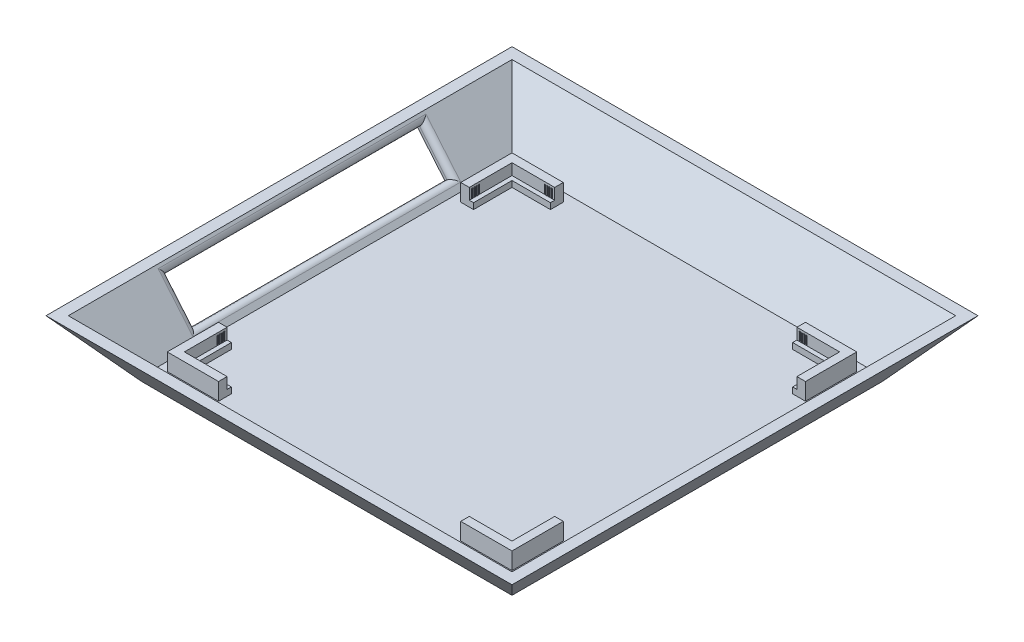
from build123d import *

# Parameters (mm, degrees)
SKETCH1_W            = 130
SKETCH1_H            = 130
BOSS_EXTRUDE1_DEPTH  = 20
BOSS_EXTRUDE1_DRAFT  = -40
SHELL1_T             = -3
BOSS_EXTRUDE2_DEPTH  = 6
BOSS_EXTRUDE3_DEPTH  = 2.1
SKETCH4_W            = 0.4
SKETCH4_H            = 3
BOSS_EXTRUDE4_DEPTH  = 0.2
CHAMFER2_SIZE        = 0.15
SKETCH5_W            = 0.4
SKETCH5_H            = 3
BOSS_EXTRUDE5_DEPTH  = 0.2
CHAMFER3_SIZE        = 0.15
SKETCH6_W            = 0.4
SKETCH6_H            = 3
BOSS_EXTRUDE6_DEPTH  = 0.2
CHAMFER4_SIZE        = 0.15
SKETCH7_W            = 0.4
SKETCH7_H            = 3
BOSS_EXTRUDE7_DEPTH  = 0.2
CHAMFER5_SIZE        = 0.15
SKETCH8_W            = 0.4
SKETCH8_H            = 3
BOSS_EXTRUDE8_DEPTH  = 0.2
CHAMFER6_SIZE        = 0.15
SKETCH9_W            = 0.4
SKETCH9_H            = 3
BOSS_EXTRUDE9_DEPTH  = 0.2
CHAMFER7_SIZE        = 0.15
SKETCH10_W           = 0.4
SKETCH10_H           = 3
BOSS_EXTRUDE10_DEPTH = 0.2
CHAMFER8_SIZE        = 0.15
SKETCH11_W           = 0.4
SKETCH11_H           = 3
BOSS_EXTRUDE11_DEPTH = 0.2
CHAMFER9_SIZE        = 0.15
SKETCH13_W           = 90
SKETCH13_H           = 15
CUT_EXTRUDE2_DEPTH   = 3.2
FILLET1_R            = 2


with BuildPart() as part:
    # Sketch1 → Boss-Extrude1 (with draft: the straight prism first)
    with BuildSketch(Plane(origin=(0, 0, 0), x_dir=(1, 0, 0), z_dir=(0, 1, 0))):
        Rectangle(SKETCH1_W, SKETCH1_H)
    extrude(amount=BOSS_EXTRUDE1_DEPTH)
    # Boss-Extrude1: the draft: its side faces are tilted about the plane it starts from
    boss_extrude1_sides = [part.faces().sort_by_distance(p)[0] for p in [
        (0, 10, 65),
        (65, 10, 0),
        (0, 10, -65),
        (-65, 10, 0),
    ]]
    draft(boss_extrude1_sides, Plane(origin=(0, 0, 0), x_dir=(1, 0, 0), z_dir=(0, 1, 0)), BOSS_EXTRUDE1_DRAFT)

    # Shell1
    shell1_openings = [part.faces().sort_by_distance(p)[0] for p in [
        (0, 20, 0),
    ]]
    offset(amount=SHELL1_T, openings=shell1_openings, kind=Kind.INTERSECTION)

    # Sketch2 → Boss-Extrude2 (add)
    with BuildSketch(Plane(origin=(0, 3, 0), x_dir=(1, 0, 0), z_dir=(0, 1, 0))):
        Polygon((-60.5, -60.5), (-42.5, -60.5), (-42.5, -57.5), (-57.5, -57.5), (-57.5, -42.5), (-60.5, -42.5), align=None)
        Polygon((57.5, -57.5), (42.5, -57.5), (42.5, -60.5), (60.5, -60.5), (60.5, -42.5), (57.5, -42.5), align=None)
        Polygon((-60.5, 42.5), (-57.5, 42.5), (-57.5, 57.5), (-42.5, 57.5), (-42.5, 60.5), (-60.5, 60.5), align=None)
        Polygon((57.5, 57.5), (57.5, 42.5), (60.5, 42.5), (60.5, 60.5), (42.5, 60.5), (42.5, 57.5), align=None)
    extrude(amount=BOSS_EXTRUDE2_DEPTH)

    # Sketch3 → Boss-Extrude3 (add)
    with BuildSketch(Plane(origin=(0, 3, 0), x_dir=(1, 0, 0), z_dir=(0, 1, 0))):
        Polygon((-57.5, -42.5), (-57.5, -57.5), (-42.5, -57.5), (-42.5, -56), (-56, -56), (-56, -42.5), align=None)
        Polygon((-57.5, 57.5), (-57.5, 42.5), (-56, 42.5), (-56, 56), (-42.5, 56), (-42.5, 57.5), align=None)
        Polygon((42.5, -56), (42.5, -57.5), (57.5, -57.5), (57.5, -42.5), (56, -42.5), (56, -56), align=None)
        Polygon((42.5, 57.5), (42.5, 56), (56, 56), (56, 42.5), (57.5, 42.5), (57.5, 57.5), align=None)
    extrude(amount=BOSS_EXTRUDE3_DEPTH)

    # Sketch4 → Boss-Extrude4 (add)
    with BuildSketch(Plane.XY.offset(-57.5)):
        with Locations((-43.5, 6.75)):
            Rectangle(SKETCH4_W, SKETCH4_H)
        with Locations((-44.3, 6.75)):
            Rectangle(SKETCH4_W, SKETCH4_H)
        with Locations((-45.1, 6.75)):
            Rectangle(SKETCH4_W, SKETCH4_H)
        with Locations((-45.9, 6.75)):
            Rectangle(SKETCH4_W, SKETCH4_H)
    extrude(amount=BOSS_EXTRUDE4_DEPTH)

    # Chamfer2
    chamfer2_edges = [part.edges().sort_by_distance(p)[0] for p in [
        (-43.3, 6.75, -57.3),
        (-43.7, 6.75, -57.3),
        (-44.1, 6.75, -57.3),
        (-44.5, 6.75, -57.3),
        (-44.9, 6.75, -57.3),
        (-45.3, 6.75, -57.3),
        (-45.7, 6.75, -57.3),
        (-46.1, 6.75, -57.3),
    ]]
    chamfer(chamfer2_edges, length=CHAMFER2_SIZE)

    # Sketch5 → Boss-Extrude5 (add)
    with BuildSketch(Plane(origin=(-57.5, 0, 0), x_dir=(0, 0, -1), z_dir=(1, 0, 0))):
        with Locations((43.5, 6.75)):
            Rectangle(SKETCH5_W, SKETCH5_H)
        with Locations((44.3, 6.75)):
            Rectangle(SKETCH5_W, SKETCH5_H)
        with Locations((45.1, 6.75)):
            Rectangle(SKETCH5_W, SKETCH5_H)
        with Locations((45.9, 6.75)):
            Rectangle(SKETCH5_W, SKETCH5_H)
    extrude(amount=BOSS_EXTRUDE5_DEPTH)

    # Chamfer3
    chamfer3_edges = [part.edges().sort_by_distance(p)[0] for p in [
        (-57.3, 6.75, -46.1),
        (-57.3, 6.75, -45.7),
        (-57.3, 6.75, -45.3),
        (-57.3, 6.75, -44.9),
        (-57.3, 6.75, -44.1),
        (-57.3, 6.75, -44.5),
        (-57.3, 6.75, -43.7),
        (-57.3, 6.75, -43.3),
    ]]
    chamfer(chamfer3_edges, length=CHAMFER3_SIZE)

    # Sketch6 → Boss-Extrude6 (add)
    with BuildSketch(Plane(origin=(-57.5, 0, 0), x_dir=(0, 0, -1), z_dir=(1, 0, 0))):
        with Locations((-43.5, 6.75)):
            Rectangle(SKETCH6_W, SKETCH6_H)
        with Locations((-44.3, 6.75)):
            Rectangle(SKETCH6_W, SKETCH6_H)
        with Locations((-45.1, 6.75)):
            Rectangle(SKETCH6_W, SKETCH6_H)
        with Locations((-45.9, 6.75)):
            Rectangle(SKETCH6_W, SKETCH6_H)
    extrude(amount=BOSS_EXTRUDE6_DEPTH)

    # Chamfer4
    chamfer4_edges = [part.edges().sort_by_distance(p)[0] for p in [
        (-57.3, 6.75, 44.5),
        (-57.3, 6.75, 44.1),
        (-57.3, 6.75, 43.3),
        (-57.3, 6.75, 43.7),
        (-57.3, 6.75, 44.9),
        (-57.3, 6.75, 45.3),
        (-57.3, 6.75, 45.7),
        (-57.3, 6.75, 46.1),
    ]]
    chamfer(chamfer4_edges, length=CHAMFER4_SIZE)

    # Sketch7 → Boss-Extrude7 (add)
    with BuildSketch(Plane(origin=(0, 0, 57.5), x_dir=(-1, 0, 0), z_dir=(0, 0, -1))):
        with Locations((43.5, 6.75)):
            Rectangle(SKETCH7_W, SKETCH7_H)
        with Locations((44.3, 6.75)):
            Rectangle(SKETCH7_W, SKETCH7_H)
        with Locations((45.1, 6.75)):
            Rectangle(SKETCH7_W, SKETCH7_H)
        with Locations((45.9, 6.75)):
            Rectangle(SKETCH7_W, SKETCH7_H)
    extrude(amount=BOSS_EXTRUDE7_DEPTH)

    # Chamfer5
    chamfer5_edges = [part.edges().sort_by_distance(p)[0] for p in [
        (-46.1, 6.75, 57.3),
        (-45.7, 6.75, 57.3),
        (-44.9, 6.75, 57.3),
        (-45.3, 6.75, 57.3),
        (-44.5, 6.75, 57.3),
        (-44.1, 6.75, 57.3),
        (-43.7, 6.75, 57.3),
        (-43.3, 6.75, 57.3),
    ]]
    chamfer(chamfer5_edges, length=CHAMFER5_SIZE)

    # Sketch8 → Boss-Extrude8 (add)
    with BuildSketch(Plane.ZY.offset(-57.5)):
        with Locations((43.5, 6.75)):
            Rectangle(SKETCH8_W, SKETCH8_H)
        with Locations((44.3, 6.75)):
            Rectangle(SKETCH8_W, SKETCH8_H)
        with Locations((45.1, 6.75)):
            Rectangle(SKETCH8_W, SKETCH8_H)
        with Locations((45.9, 6.75)):
            Rectangle(SKETCH8_W, SKETCH8_H)
    extrude(amount=BOSS_EXTRUDE8_DEPTH)

    # Chamfer6
    chamfer6_edges = [part.edges().sort_by_distance(p)[0] for p in [
        (57.3, 6.75, 46.1),
        (57.3, 6.75, 45.7),
        (57.3, 6.75, 45.3),
        (57.3, 6.75, 44.9),
        (57.3, 6.75, 44.5),
        (57.3, 6.75, 44.1),
        (57.3, 6.75, 43.7),
        (57.3, 6.75, 43.3),
    ]]
    chamfer(chamfer6_edges, length=CHAMFER6_SIZE)

    # Sketch9 → Boss-Extrude9 (add)
    with BuildSketch(Plane(origin=(0, 0, 57.5), x_dir=(-1, 0, 0), z_dir=(0, 0, -1))):
        with Locations((-43.45, 6.75)):
            Rectangle(SKETCH9_W, SKETCH9_H)
        with Locations((-44.25, 6.75)):
            Rectangle(SKETCH9_W, SKETCH9_H)
        with Locations((-45.05, 6.75)):
            Rectangle(SKETCH9_W, SKETCH9_H)
        with Locations((-45.85, 6.75)):
            Rectangle(SKETCH9_W, SKETCH9_H)
    extrude(amount=BOSS_EXTRUDE9_DEPTH)

    # Chamfer7
    chamfer7_edges = [part.edges().sort_by_distance(p)[0] for p in [
        (43.25, 6.75, 57.3),
        (43.65, 6.75, 57.3),
        (44.05, 6.75, 57.3),
        (44.45, 6.75, 57.3),
        (44.85, 6.75, 57.3),
        (45.25, 6.75, 57.3),
        (45.65, 6.75, 57.3),
        (46.05, 6.75, 57.3),
    ]]
    chamfer(chamfer7_edges, length=CHAMFER7_SIZE)

    # Sketch10 → Boss-Extrude10 (add)
    with BuildSketch(Plane.XY.offset(-57.5)):
        with Locations((43.5, 6.75)):
            Rectangle(SKETCH10_W, SKETCH10_H)
        with Locations((44.3, 6.75)):
            Rectangle(SKETCH10_W, SKETCH10_H)
        with Locations((45.1, 6.75)):
            Rectangle(SKETCH10_W, SKETCH10_H)
        with Locations((45.9, 6.75)):
            Rectangle(SKETCH10_W, SKETCH10_H)
    extrude(amount=BOSS_EXTRUDE10_DEPTH)

    # Chamfer8
    chamfer8_edges = [part.edges().sort_by_distance(p)[0] for p in [
        (46.1, 6.75, -57.3),
        (45.7, 6.75, -57.3),
        (45.3, 6.75, -57.3),
        (44.9, 6.75, -57.3),
        (44.5, 6.75, -57.3),
        (44.1, 6.75, -57.3),
        (43.7, 6.75, -57.3),
        (43.3, 6.75, -57.3),
    ]]
    chamfer(chamfer8_edges, length=CHAMFER8_SIZE)

    # Sketch11 → Boss-Extrude11 (add)
    with BuildSketch(Plane.ZY.offset(-57.5)):
        with Locations((-43.5, 6.75)):
            Rectangle(SKETCH11_W, SKETCH11_H)
        with Locations((-44.3, 6.75)):
            Rectangle(SKETCH11_W, SKETCH11_H)
        with Locations((-45.1, 6.75)):
            Rectangle(SKETCH11_W, SKETCH11_H)
        with Locations((-45.9, 6.75)):
            Rectangle(SKETCH11_W, SKETCH11_H)
    extrude(amount=BOSS_EXTRUDE11_DEPTH)

    # Chamfer9
    chamfer9_edges = [part.edges().sort_by_distance(p)[0] for p in [
        (57.3, 6.75, -43.3),
        (57.3, 6.75, -43.7),
        (57.3, 6.75, -44.1),
        (57.3, 6.75, -44.5),
        (57.3, 6.75, -44.9),
        (57.3, 6.75, -45.3),
        (57.3, 6.75, -45.7),
        (57.3, 6.75, -46.1),
    ]]
    chamfer(chamfer9_edges, length=CHAMFER9_SIZE)

    # Sketch13 → Cut-Extrude2 (cut)
    with BuildSketch(Plane(origin=(-38.143565774, -32.006251973, 0), x_dir=(0, 0, 1), z_dir=(-0.7660444431189777, -0.6427876096865398, 0))):
        with Locations((0, 54.834340416)):
            Rectangle(SKETCH13_W, SKETCH13_H)
    extrude(amount=-CUT_EXTRUDE2_DEPTH, mode=Mode.SUBTRACT)

    # Fillet1
    fillet1_edges = [part.edges().sort_by_distance(p)[0] for p in [
        (-71.09226705, 11.927652624, -45),
        (-66.271359977, 6.182319301, 0),
        (-75.913174122, 17.672985948, 0),
        (-71.09226705, 11.927652624, 45),
    ]]
    fillet(fillet1_edges, radius=FILLET1_R)


solid = part.part
